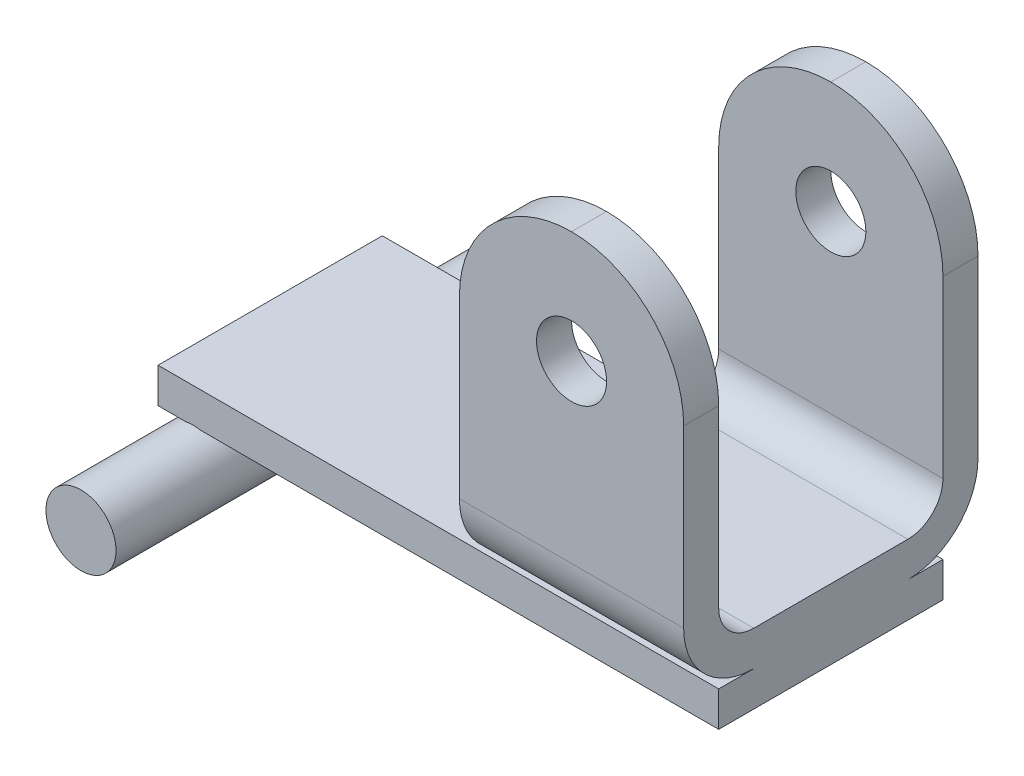
from build123d import *

# Parameters (mm, degrees)
ESQUISSE1_R             = 0.5
BASE_EXTRUSION_DEPTH    = 3.2
ESQUISSE2_W             = 8
ESQUISSE2_H             = 0.5
BOSS_EXTRU_3_DEPTH      = 1.6
BOSS_EXTRU_MINCE1_DEPTH = 3.2
ESQUISSE4_R             = 0.5
ENL_V_MAT_EXTRU_1_DEPTH = 12.01944191
CONG_1_R                = 1.6


with BuildPart() as part:
    # Esquisse1 → Base-Extrusion (new, symmetric)
    with BuildSketch(Plane.XY):
        Circle(ESQUISSE1_R)
    extrude(amount=BASE_EXTRUSION_DEPTH, both=True)

    # Esquisse2 → Boss.-Extru.3 (add, symmetric)
    with BuildSketch(Plane.XY):
        with Locations((3.5, 0.74)):
            Rectangle(ESQUISSE2_W, ESQUISSE2_H)
    extrude(amount=BOSS_EXTRU_3_DEPTH, both=True)

    # Esquisse3 → Boss.-Extru.-Mince1 (add)
    with BuildSketch(Plane(origin=(7.5, 0, 0), x_dir=(0, 0, -1), z_dir=(1, 0, 0))):
        with BuildLine():
            Line((-2.1, 6.09), (-2.1, 1.99))
            ThreePointArc((-2.1, 1.99), (-1.807106781, 1.282893219), (-1.1, 0.99))
            Line((-1.1, 0.99), (1.1, 0.99))
            ThreePointArc((1.1, 0.99), (1.807106781, 1.282893219), (2.1, 1.99))
            Line((2.1, 1.99), (2.1, 6.09))
            Line((2.1, 6.09), (1.6, 6.09))
            Line((1.6, 6.09), (1.6, 1.99))
            ThreePointArc((1.6, 1.99), (1.453553391, 1.636446609), (1.1, 1.49))
            Line((1.1, 1.49), (-1.1, 1.49))
            ThreePointArc((-1.1, 1.49), (-1.453553391, 1.636446609), (-1.6, 1.99))
            Line((-1.6, 1.99), (-1.6, 6.09))
            Line((-1.6, 6.09), (-2.1, 6.09))
        make_face()
    extrude(amount=-BOSS_EXTRU_MINCE1_DEPTH)

    # Esquisse4 → Enlèv. mat.-Extru.1 (cut, through all)
    with BuildSketch(Plane.XY.offset(2.1)):
        with Locations((5.9, 4.49)):
            Circle(ESQUISSE4_R)
    extrude(amount=-ENL_V_MAT_EXTRU_1_DEPTH, mode=Mode.SUBTRACT)

    # Congé1
    cong_1_edges = [part.edges().sort_by_distance(p)[0] for p in [
        (7.5, 6.09, 1.85),
        (7.5, 6.09, -1.85),
        (4.3, 6.09, 1.85),
        (4.3, 6.09, -1.85),
    ]]
    fillet(cong_1_edges, radius=CONG_1_R - 0.0001)  # a hair under: the kernel refuses the full size


solid = part.part
